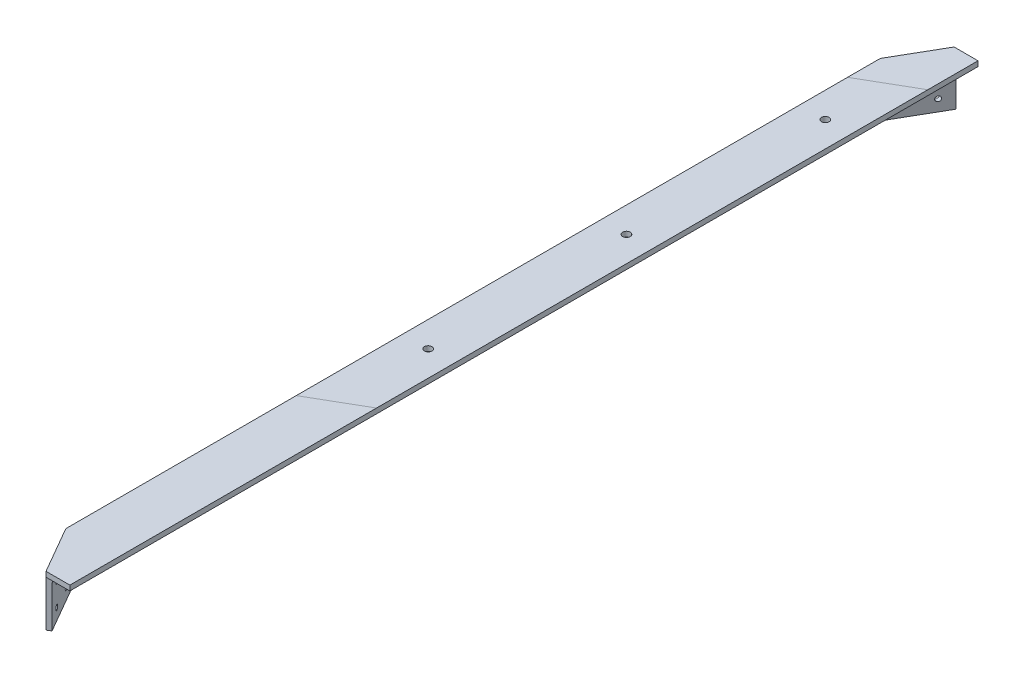
from build123d import *

# Parameters (mm, degrees)
BOSS_EXTRUDE1_DEPTH  = 640
BOSS_EXTRUDE2_DEPTH  = 8
BOSS_EXTRUDE3_DEPTH  = 72
SKETCH6_R            = 4
CUT_EXTRUDE1_DEPTH   = 8
FILLET1_R            = 10
FILLET2_R            = 8
FILLET1_OF_MIRROR1_R = 10
FILLET2_OF_MIRROR1_R = 8
SKETCH10_R           = 6
CUT_EXTRUDE2_DEPTH   = 8


with BuildPart() as part:
    # Sketch1 → Boss-Extrude1 (new body)
    with BuildSketch(Plane.XY):
        Polygon((-8, 8), (72, 8), (72, 0), (0, 0), (0, -72), (-8, -72), align=None)
    boss_extrude1 = extrude(amount=BOSS_EXTRUDE1_DEPTH)

    # Sketch3 → Boss-Extrude2 (add)
    with BuildSketch(Plane(origin=(0, 0, 0), x_dir=(1, 0, 0), z_dir=(0, 1, 0))):
        Polygon((-8, -640), (34.5, -713.612159322), (72, -713.612159322), (72, -640), align=None)
    boss_extrude2 = extrude(amount=BOSS_EXTRUDE2_DEPTH)

    # Sketch4 → Boss-Extrude3 (add)
    with BuildSketch(Plane.XZ):
        Polygon((-8, 640), (34.5, 713.612159322), (40.5, 710.148057707), (0, 640), align=None)
    boss_extrude3 = extrude(amount=BOSS_EXTRUDE3_DEPTH)

    # Sketch6 → Cut-Extrude1 (cut)
    with BuildSketch(Plane(origin=(-277.128129211, 0, 160), x_dir=(-0.4999999999999956, 0, -0.8660254037844413), z_dir=(0.8660254037844413, 0, -0.4999999999999956))):
        with Locations((-615.006258422, -18)):
            Circle(SKETCH6_R)
        with Locations((-574.506258422, -18)):
            Circle(SKETCH6_R)
        with Locations((-574.506258422, -54)):
            Circle(SKETCH6_R)
        with Locations((-615.006258422, -54)):
            Circle(SKETCH6_R)
    cut_extrude1 = extrude(amount=-CUT_EXTRUDE1_DEPTH, mode=Mode.SUBTRACT)

    # Fillet1
    fillet1_edges = [part.edges().sort_by_distance(p)[0] for p in [
        (-8, -32, 640),
        (0, -36, 640),
    ]]
    fillet(fillet1_edges, radius=FILLET1_R)

    # Fillet2
    fillet2_edges = [part.edges().sort_by_distance(p)[0] for p in [
        (0, 0, 318.660254038),
        (0.340741737, 0, 639.908698527),
        (20.919872981, 0, 676.234282891),
    ]]
    fillet(fillet2_edges, radius=FILLET2_R)

    # Mirror1: Boss-Extrude1, Boss-Extrude2, Boss-Extrude3, Cut-Extrude1 across plane
    add(boss_extrude1.mirror(Plane.XY))
    add(boss_extrude2.mirror(Plane.XY))
    add(boss_extrude3.mirror(Plane.XY))
    add(cut_extrude1.mirror(Plane.XY), mode=Mode.SUBTRACT)

    # Fillet1 of Mirror1
    fillet1_of_mirror1_edges = [part.edges().sort_by_distance(p)[0] for p in [
        (-8, -32, -640),
        (0, -36, -640),
    ]]
    fillet(fillet1_of_mirror1_edges, radius=FILLET1_OF_MIRROR1_R)

    # Fillet2 of Mirror1
    fillet2_of_mirror1_edges = [part.edges().sort_by_distance(p)[0] for p in [
        (0, 0, -318.660254038),
        (0.340741737, 0, -639.908698527),
        (20.919872981, 0, -676.234282891),
    ]]
    fillet(fillet2_of_mirror1_edges, radius=FILLET2_OF_MIRROR1_R)

    # Sketch10 → Cut-Extrude2 (cut)
    with BuildSketch(Plane(origin=(0, 8, 0), x_dir=(1, 0, 0), z_dir=(0, 1, 0))):
        with Locations((32, 513.612159322)):
            Circle(SKETCH10_R)
        with Locations((32, 201.112159322)):
            Circle(SKETCH10_R)
        with Locations((32, -110.512159322)):
            Circle(SKETCH10_R)
    extrude(amount=-CUT_EXTRUDE2_DEPTH, mode=Mode.SUBTRACT)


solid = part.part
